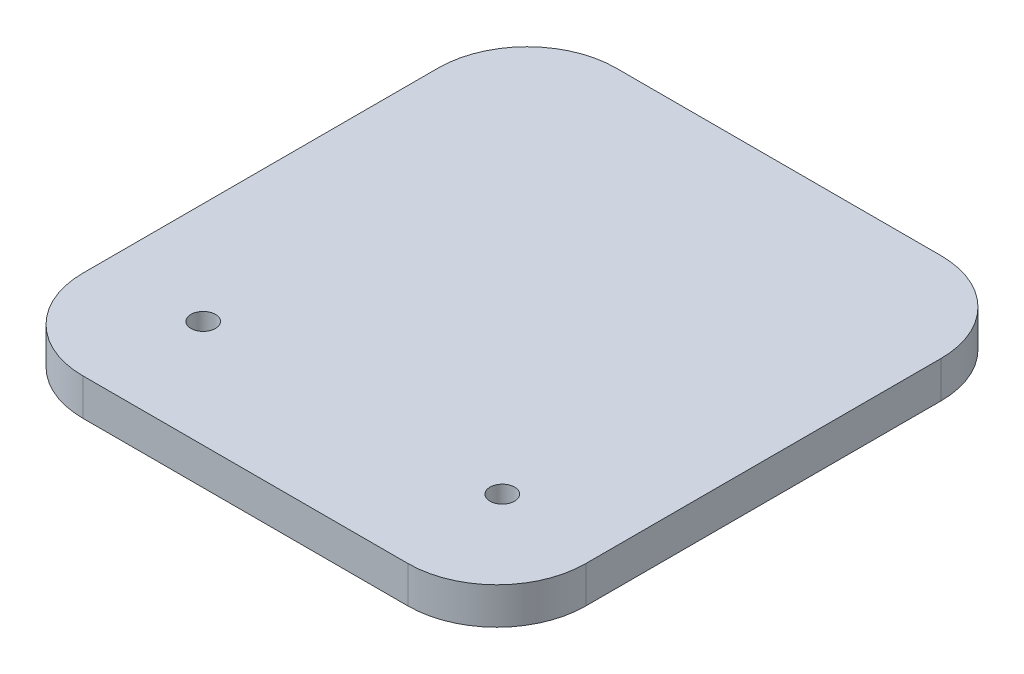
from build123d import *

# Parameters (mm, degrees)
SKETCH2_W           = 71.882
SKETCH2_H           = 76.2
BOSS_EXTRUDE2_DEPTH = 5.2578
CAVITY1_START       = 9.525
CAVITY1_OUTLINE_R   = 1.7526
CAVITY1_DEPTH       = 5.2578
FILLET3_R           = 12.7
FILLET4_R           = 12.7
FILLET5_R           = 12.7
FILLET6_R           = 12.7


# Read off the part's stored shape, not the designer's step: Cavity1
with BuildPart() as part:
    # Sketch2 → Boss-Extrude2 (new body)
    with BuildSketch(Plane(origin=(0, 9.525, 0), x_dir=(1, 0, 0), z_dir=(0, 1, 0))):
        with Locations((4.191, 35.4711)):
            Rectangle(SKETCH2_W, SKETCH2_H)
    extrude(amount=BOSS_EXTRUDE2_DEPTH)

    # Cavity1 outline → Cavity1 (cut)
    with BuildSketch(Plane(origin=(0, 0, 0), x_dir=(1, 0, 0), z_dir=(0, 1, 0)).offset(CAVITY1_START)):
        with Locations((25.576048817, 12.7)):
            Circle(CAVITY1_OUTLINE_R)
        with Locations((-17.177400647, 12.7)):
            Circle(CAVITY1_OUTLINE_R)
    extrude(amount=CAVITY1_DEPTH, mode=Mode.SUBTRACT)

    # Fillet3
    fillet3_edges = [part.edges().sort_by_distance(p)[0] for p in [
        (40.132, 12.1539, 2.6289),
    ]]
    fillet(fillet3_edges, radius=FILLET3_R)

    # Fillet4
    fillet4_edges = [part.edges().sort_by_distance(p)[0] for p in [
        (-31.75, 12.1539, 2.6289),
    ]]
    fillet(fillet4_edges, radius=FILLET4_R)

    # Fillet5
    fillet5_edges = [part.edges().sort_by_distance(p)[0] for p in [
        (40.132, 12.1539, -73.5711),
    ]]
    fillet(fillet5_edges, radius=FILLET5_R)

    # Fillet6
    fillet6_edges = [part.edges().sort_by_distance(p)[0] for p in [
        (-31.75, 12.1539, -73.5711),
    ]]
    fillet(fillet6_edges, radius=FILLET6_R)


solid = part.part
